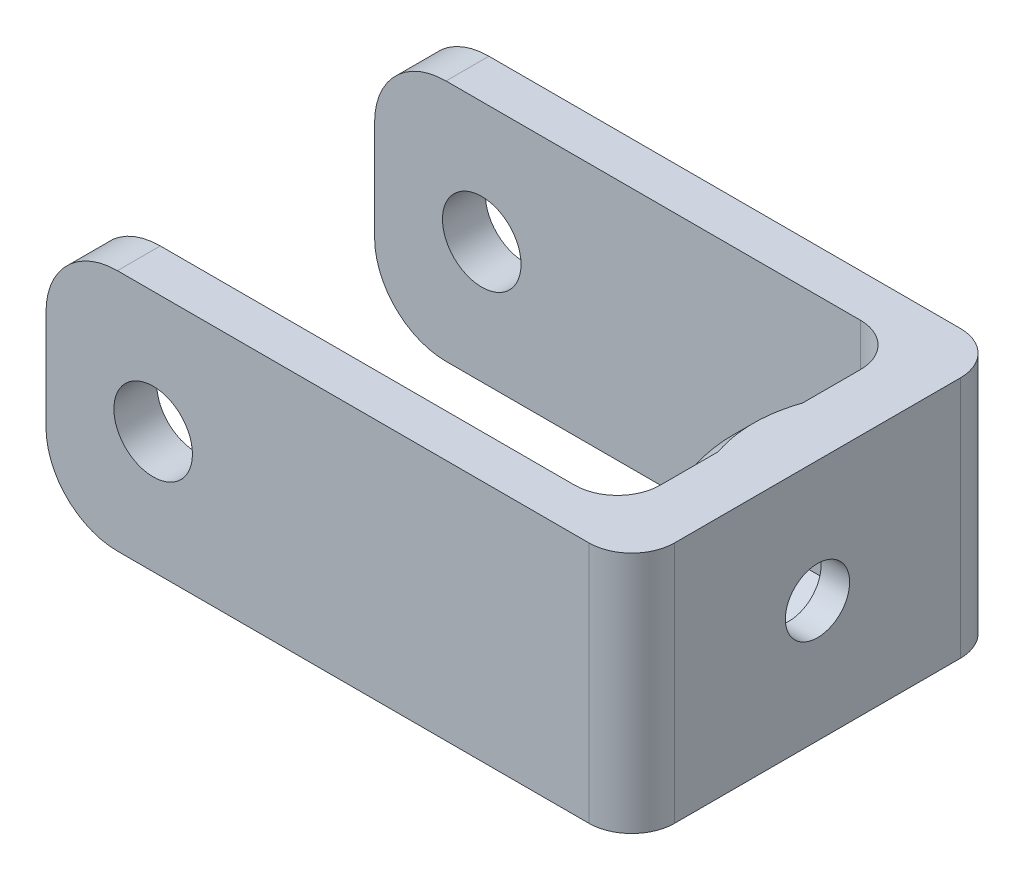
from build123d import *

# Parameters (mm, degrees)
SKETCH1_W           = 26
SKETCH1_H           = 17
BOSS_EXTRUDE1_DEPTH = 4
SKETCH2_W           = 3
SKETCH2_H           = 17
BOSS_EXTRUDE2_DEPTH = 37
SKETCH3_R           = 2.75
CUT_EXTRUDE1_DEPTH  = 47.013584951
FILLET1_R           = 3
FILLET2_R           = 5
SKETCH5_R           = 7
BOSS_EXTRUDE3_DEPTH = 2
CUT_EXTRUDE3_REACH  = 45.843
SKETCH7_R           = 2.25
CUT_EXTRUDE4_DEPTH  = 4
CHAMFER1_SIZE       = 2


with BuildPart() as part:
    # Sketch1 → Boss-Extrude1 (new body)
    with BuildSketch(Plane(origin=(0, 0, 0), x_dir=(0, 0, -1), z_dir=(1, 0, 0))):
        Rectangle(SKETCH1_W, SKETCH1_H)
    extrude(amount=BOSS_EXTRUDE1_DEPTH)

    # Sketch2 → Boss-Extrude2 (add)
    with BuildSketch(Plane.ZY):
        with Locations((-11.5, 0)):
            Rectangle(SKETCH2_W, SKETCH2_H)
        with Locations((11.5, 0)):
            Rectangle(SKETCH2_W, SKETCH2_H)
    extrude(amount=BOSS_EXTRUDE2_DEPTH)

    # Sketch3 → Cut-Extrude1 (cut, through all)
    with BuildSketch(Plane.XY.offset(13)):
        with Locations((-29.5, 0)):
            Circle(SKETCH3_R)
    extrude(amount=-CUT_EXTRUDE1_DEPTH, mode=Mode.SUBTRACT)

    # Fillet1
    fillet1_edges = [part.edges().sort_by_distance(p)[0] for p in [
        (4, 0, 13),
        (0, 0, -10),
        (0, 0, 10),
        (4, 0, -13),
    ]]
    fillet(fillet1_edges, radius=FILLET1_R)

    # Fillet2
    fillet2_edges = [part.edges().sort_by_distance(p)[0] for p in [
        (-37, -8.5, -11.5),
        (-37, 8.5, -11.5),
        (-37, 8.5, 11.5),
        (-37, -8.5, 11.5),
    ]]
    fillet(fillet2_edges, radius=FILLET2_R)

    # Sketch5 → Boss-Extrude3 (add)
    with BuildSketch(Plane.ZY):
        Circle(SKETCH5_R)
    extrude(amount=BOSS_EXTRUDE3_DEPTH)

    # Sketch7 → Cut-Extrude3 (cut, up to next)
    with BuildSketch(Plane(origin=(4, 0, 0), x_dir=(0, 0, -1), z_dir=(1, 0, 0)), mode=Mode.PRIVATE) as cut_extrude3_sk1:
        Circle(SKETCH7_R)
    cut_extrude3_tool1 = extrude(cut_extrude3_sk1.sketch, amount=-CUT_EXTRUDE3_REACH, mode=Mode.PRIVATE) & part.part
    add(cut_extrude3_tool1.solids().sort_by_distance((4, 0, 0))[0], mode=Mode.SUBTRACT)

    # Sketch8 → Cut-Extrude4 (cut)
    with BuildSketch(Plane.ZY.offset(2)):
        Polygon((0, 4.330127019), (-3.75, 2.165063509), (-3.75, -2.165063509), (0, -4.330127019), (3.75, -2.165063509), (3.75, 2.165063509), align=None)
    extrude(amount=-CUT_EXTRUDE4_DEPTH, mode=Mode.SUBTRACT)

    # Chamfer1
    # the kernel refuses this chamfer: 2 mm, written as the material it adds along each edge
    with BuildSketch(Plane(origin=(0, 0, 0), x_dir=(0, 0, 1), z_dir=(0, -1, 0))) as chamfer1_piece_1_section:
        Polygon((7 + CHAMFER1_SIZE, 0), (7, CHAMFER1_SIZE), (7, 0), align=None)
    chamfer1_piece_1 = revolve(axis=Axis((0, 0, 0), (-1, 0, 0)), revolution_arc=180, mode=Mode.PRIVATE)
    chamfer1_piece_1 = split(chamfer1_piece_1, bisect_by=Plane(origin=(-0.945270908, 8.5, 0), z_dir=(0, -1, 0)), keep=Keep.TOP, mode=Mode.PRIVATE)
    chamfer1_piece_1 = split(chamfer1_piece_1, bisect_by=Plane(origin=(-2, 8.001839451, 0), z_dir=(1, 0, 0)), keep=Keep.TOP, mode=Mode.PRIVATE)
    add(chamfer1_piece_1)
    with BuildSketch(Plane(origin=(0, 0, 0), x_dir=(0, 0, -1), z_dir=(0, 1, 0))) as chamfer1_piece_2_section:
        Polygon((7 + CHAMFER1_SIZE, 0), (7, CHAMFER1_SIZE), (7, 0), align=None)
    chamfer1_piece_2 = revolve(axis=Axis((0, 0, 0), (-1, 0, 0)), revolution_arc=180, mode=Mode.PRIVATE)
    chamfer1_piece_2 = split(chamfer1_piece_2, bisect_by=Plane(origin=(-0.945270905, -8.5, 0), z_dir=(0, 1, 0)), keep=Keep.TOP, mode=Mode.PRIVATE)
    chamfer1_piece_2 = split(chamfer1_piece_2, bisect_by=Plane(origin=(-2, -8.001839447, 0), z_dir=(1, 0, 0)), keep=Keep.TOP, mode=Mode.PRIVATE)
    add(chamfer1_piece_2)


solid = part.part
